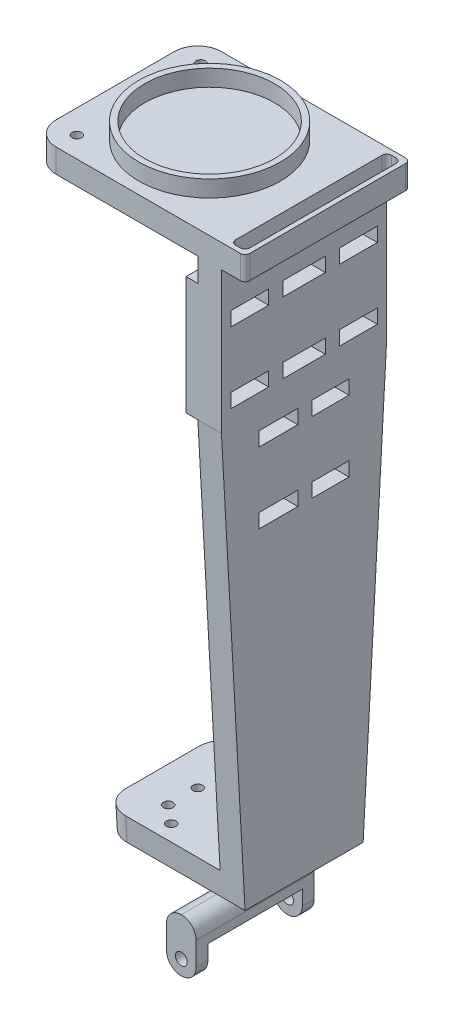
from build123d import *

# Parameters (mm, degrees)
SKETCH1_W                = 80
SKETCH1_H                = 70
BOSS_EXTRUDE1_DEPTH      = 10
SKETCH2_W                = 10
SKETCH2_H                = 70
BOSS_EXTRUDE2_DEPTH      = 450
SKETCH3_R                = 30
SKETCH3_R_2              = 27.5
BOSS_EXTRUDE3_DEPTH      = 7
SKETCH6_R                = 2
CUT_EXTRUDE3_DEPTH       = 27
SKETCH7_W                = 70
SKETCH7_H                = 210
CUT_EXTRUDE4_DEPTH       = 27
CUT_EXTRUDE5_DEPTH       = 70
BOSS_EXTRUDE5_DEPTH      = 50
SKETCH12_R               = 10
SKETCH12_R_2             = 7.5
SKETCH12_R_3             = 2.5
BOSS_EXTRUDE6_DEPTH      = 25
SKETCH13_R               = 2
CUT_EXTRUDE6_DEPTH       = 25
SKETCH14_W               = 24
SKETCH14_H               = 50
SKETCH14_W_2             = 20
SKETCH14_H_2             = 46
BOSS_EXTRUDE7_DEPTH      = 5
SKETCH15_W               = 24
SKETCH15_H               = 50
SKETCH15_W_2             = 20
SKETCH15_H_2             = 46
BOSS_EXTRUDE8_DEPTH      = 5
SKETCH16_W               = 22
SKETCH16_H               = 2
BOSS_EXTRUDE9_DEPTH      = 5
SKETCH17_W               = 46
SKETCH17_H               = 50
SKETCH17_W_2             = 19.659007001
SKETCH17_H_2             = 46
SKETCH17_W_3             = 20.340992999
BOSS_EXTRUDE10_DEPTH     = 5
SKETCH18_W               = 16
SKETCH18_H               = 6
SKETCH18_W_2             = 18
CUT_EXTRUDE8_DEPTH       = 10
SKETCH19_W               = 15.659007001
SKETCH19_H               = 6
SKETCH19_W_2             = 16.340992999
CUT_EXTRUDE9_DEPTH       = 10
FILLET1_R                = 10
FILLET2_R                = 10
SKETCH20_W               = 70
SKETCH20_H               = 10
BOSS_EXTRUDE11_DEPTH     = 10
SKETCH21_W               = 6
SKETCH21_H               = 66
CUT_EXTRUDE10_DEPTH      = 10
FILLET3_R                = 2
FILLET4_R                = 2
FILLET5_R                = 2
SKETCH23_W               = 25.167549862
SKETCH23_H               = 25.727851888
CUT_EXTRUDE12_DEPTH      = 116
SKETCH25_R               = 6.25
BOSS_EXTRUDE12_DEPTH     = 15
SKETCH26_W               = 12.5
SKETCH26_H               = 21
SKETCH26_H_2             = 4
BOSS_EXTRUDE13_DEPTH     = 10
SKETCH27_W               = 12.5
SKETCH27_H               = 5
BOSS_EXTRUDE15_DEPTH     = 12.5
FILLET8_R                = 6.25
CUT_EXTRUDE14_DEPTH      = 52.5
CUT_EXTRUDE14_DEPTH_BACK = 12.5
SKETCH29_R               = 2.5
FILLET9_R                = 6.25
SKETCH30_W               = 1
SKETCH30_H               = 46
BOSS_EXTRUDE16_DEPTH     = 5


# Some blends are built 0.0001 mm under size
with BuildPart() as part:
    # Sketch1 → Boss-Extrude1 (new body)
    with BuildSketch(Plane(origin=(0, 0, 0), x_dir=(1, 0, 0), z_dir=(0, 1, 0))):
        with Locations((-40, -35)):
            Rectangle(SKETCH1_W, SKETCH1_H)
    extrude(amount=BOSS_EXTRUDE1_DEPTH)

    # Sketch2 → Boss-Extrude2 (add)
    with BuildSketch(Plane.XZ):
        with Locations((-5, 35)):
            Rectangle(SKETCH2_W, SKETCH2_H)
    extrude(amount=BOSS_EXTRUDE2_DEPTH)

    # Sketch3 → Boss-Extrude3 (add)
    with BuildSketch(Plane(origin=(0, 10, 0), x_dir=(1, 0, 0), z_dir=(0, 1, 0))):
        with Locations(Location((-40, -35, 0), (0, 0, 90))):
            Circle(SKETCH3_R)
        with Locations(Location((-40, -35, 0), (0, 0, 270))):
            Circle(SKETCH3_R_2, mode=Mode.SUBTRACT)
    extrude(amount=BOSS_EXTRUDE3_DEPTH)

    # Sketch6 → Cut-Extrude3 (cut)
    with BuildSketch(Plane(origin=(0, 10, 0), x_dir=(1, 0, 0), z_dir=(0, 1, 0))):
        with Locations(Location((-70, -61.25, 0), (0, 0, 270))):
            Circle(SKETCH6_R)
        with Locations(Location((-70, -8.75, 0), (0, 0, 270))):
            Circle(SKETCH6_R)
    extrude(amount=-CUT_EXTRUDE3_DEPTH, mode=Mode.SUBTRACT)

    # Sketch7 → Cut-Extrude4 (cut)
    with BuildSketch(Plane.ZY.offset(10)):
        with Locations((35, -345)):
            Rectangle(SKETCH7_W, SKETCH7_H)
    extrude(amount=-CUT_EXTRUDE4_DEPTH, mode=Mode.SUBTRACT)

    # Sketch10 → Cut-Extrude5 (cut)
    with BuildSketch(Plane.ZY.offset(10)):
        Polygon((0, -60), (10, -240), (0, -240), align=None)
        Polygon((70, -60), (60, -240), (70, -240), align=None)
    extrude(amount=-CUT_EXTRUDE5_DEPTH, mode=Mode.SUBTRACT)

    # Sketch11 → Boss-Extrude5 (add)
    with BuildSketch(Plane.ZY.offset(10)):
        Polygon((10.116578541, -240), (60, -240), (60.555555556, -230), (9.444444444, -230), align=None)
    extrude(amount=BOSS_EXTRUDE5_DEPTH)

    # Sketch12 → Boss-Extrude6 (add)
    # profile 1 of 2: a face of its own
    with BuildSketch(Plane.XZ.offset(240)):
        with Locations(Location((-30, 35, 0), (0, 0, 90))):
            Circle(SKETCH12_R)
        with Locations(Location((-30, 35, 0), (0, 0, 270))):
            Circle(SKETCH12_R_2, mode=Mode.SUBTRACT)
    # profile 2 of 2: a face of its own
    with BuildSketch(Plane.XZ.offset(240)):
        with Locations(Location((-30, 35, 0), (0, 0, 90))):
            Circle(SKETCH12_R_3)
    extrude(amount=BOSS_EXTRUDE6_DEPTH)

    # Sketch13 → Cut-Extrude6 (cut)
    with BuildSketch(Plane(origin=(0, -240, 0), x_dir=(-1, 0, 0), z_dir=(0, -1, 0))):
        with Locations(Location((45, -47.529144635, 0), (0, 0, 90))):
            Circle(SKETCH13_R)
        with Locations(Location((45, -22.558289271, 0), (0, 0, 90))):
            Circle(SKETCH13_R)
        with Locations(Location((45, -35.043716953, 0), (0, 0, 90))):
            Circle(SKETCH13_R)
        with Locations(Location((37.5, -53.764572318, 0), (0, 0, 90))):
            Circle(SKETCH13_R)
        with Locations(Location((37.5, -16.308289271, 0), (0, 0, 90))):
            Circle(SKETCH13_R)
    extrude(amount=-CUT_EXTRUDE6_DEPTH, mode=Mode.SUBTRACT)

    # Sketch14 → Boss-Extrude7 (add)
    with BuildSketch(Plane.ZY.offset(10)):
        with Locations((12, -35)):
            Rectangle(SKETCH14_W, SKETCH14_H)
        with Locations((12, -35)):
            Rectangle(SKETCH14_W_2, SKETCH14_H_2, mode=Mode.SUBTRACT)
    extrude(amount=BOSS_EXTRUDE7_DEPTH)

    # Sketch15 → Boss-Extrude8 (add)
    with BuildSketch(Plane.ZY.offset(10)):
        with Locations((58, -35)):
            Rectangle(SKETCH15_W, SKETCH15_H)
        with Locations((58, -35)):
            Rectangle(SKETCH15_W_2, SKETCH15_H_2, mode=Mode.SUBTRACT)
    extrude(amount=BOSS_EXTRUDE8_DEPTH)

    # Sketch16 → Boss-Extrude9 (add)
    with BuildSketch(Plane.ZY.offset(10)):
        with Locations((35, -11)):
            Rectangle(SKETCH16_W, SKETCH16_H)
        with Locations((35, -59)):
            Rectangle(SKETCH16_W, SKETCH16_H)
    extrude(amount=BOSS_EXTRUDE9_DEPTH)

    # Sketch17 → Boss-Extrude10 (add)
    with BuildSketch(Plane.ZY.offset(10)):
        with Locations((35, -85)):
            Rectangle(SKETCH17_W, SKETCH17_H)
        with Locations((23.8295035, -85)):
            Rectangle(SKETCH17_W_2, SKETCH17_H_2, mode=Mode.SUBTRACT)
        with Locations((45.8295035, -85)):
            Rectangle(SKETCH17_W_3, SKETCH17_H_2, mode=Mode.SUBTRACT)
    extrude(amount=BOSS_EXTRUDE10_DEPTH)

    # Sketch18 → Cut-Extrude8 (cut)
    with BuildSketch(Plane.ZY.offset(10)):
        with Locations((12, -20)):
            Rectangle(SKETCH18_W, SKETCH18_H)
        with Locations((35, -20)):
            Rectangle(SKETCH18_W_2, SKETCH18_H)
        with Locations((58, -20)):
            Rectangle(SKETCH18_W, SKETCH18_H)
        with Locations((12, -50)):
            Rectangle(SKETCH18_W, SKETCH18_H)
        with Locations((35, -50)):
            Rectangle(SKETCH18_W_2, SKETCH18_H)
        with Locations((58, -50)):
            Rectangle(SKETCH18_W, SKETCH18_H)
    extrude(amount=-CUT_EXTRUDE8_DEPTH, mode=Mode.SUBTRACT)

    # Sketch19 → Cut-Extrude9 (cut)
    with BuildSketch(Plane.ZY.offset(10)):
        with Locations((23.829503501, -70)):
            Rectangle(SKETCH19_W, SKETCH19_H)
        with Locations((23.829503501, -100)):
            Rectangle(SKETCH19_W, SKETCH19_H)
        with Locations((45.8295035, -70)):
            Rectangle(SKETCH19_W_2, SKETCH19_H)
        with Locations((45.8295035, -100)):
            Rectangle(SKETCH19_W_2, SKETCH19_H)
    extrude(amount=-CUT_EXTRUDE9_DEPTH, mode=Mode.SUBTRACT)

    # Fillet1
    fillet1_edges = [part.edges().sort_by_distance(p)[0] for p in [
        (-80, 5, 0),
        (-80, 5, 70),
    ]]
    fillet(fillet1_edges, radius=FILLET1_R)

    # Fillet2
    fillet2_edges = [part.edges().sort_by_distance(p)[0] for p in [
        (-60, -235, 9.780511493),
        (-60, -235, 60.277777778),
    ]]
    fillet(fillet2_edges, radius=FILLET2_R)

    # Sketch20 → Boss-Extrude11 (add)
    with BuildSketch(Plane(origin=(0, 0, 0), x_dir=(0, 0, -1), z_dir=(1, 0, 0))):
        with Locations((-35, 5)):
            Rectangle(SKETCH20_W, SKETCH20_H)
    extrude(amount=BOSS_EXTRUDE11_DEPTH)

    # Sketch21 → Cut-Extrude10 (cut)
    with BuildSketch(Plane.XZ):
        with Locations((5, 35)):
            Rectangle(SKETCH21_W, SKETCH21_H)
    extrude(amount=-CUT_EXTRUDE10_DEPTH, mode=Mode.SUBTRACT)

    # Fillet3
    fillet3_edges = [part.edges().sort_by_distance(p)[0] for p in [
        (10, 5, 70),
        (10, 5, 0),
    ]]
    fillet(fillet3_edges, radius=FILLET3_R)

    # Fillet4
    fillet4_edges = [part.edges().sort_by_distance(p)[0] for p in [
        (8, 5, 68),
        (8, 5, 2),
    ]]
    fillet(fillet4_edges, radius=FILLET4_R)

    # Fillet5
    fillet5_edges = [part.edges().sort_by_distance(p)[0] for p in [
        (2, 5, 2),
        (2, 5, 68),
    ]]
    fillet(fillet5_edges, radius=FILLET5_R)

    # Sketch23 → Cut-Extrude12 (cut)
    with BuildSketch(Plane.XZ.offset(240)):
        with Locations((-28.923795104, 37.128742303)):
            Rectangle(SKETCH23_W, SKETCH23_H)
    extrude(amount=CUT_EXTRUDE12_DEPTH, mode=Mode.SUBTRACT)

    # Sketch25 → Boss-Extrude12 (add)
    with BuildSketch(Plane(origin=(0, -240, 0), x_dir=(-1, 0, 0), z_dir=(0, -1, 0))):
        with Locations(Location((26.99513388, -35, 0), (0, 0, 270))):
            Circle(SKETCH25_R)
    extrude(amount=BOSS_EXTRUDE12_DEPTH)

    # Sketch26 → Boss-Extrude13 (add)
    with BuildSketch(Plane(origin=(0, -255, 0), x_dir=(-1, 0, 0), z_dir=(0, -1, 0))):
        with Locations((26.99513388, -45.5)):
            Rectangle(SKETCH26_W, SKETCH26_H)
        with Locations((26.99513388, -24.5)):
            Rectangle(SKETCH26_W, SKETCH26_H)
        with Locations((26.99513388, -12)):
            Rectangle(SKETCH26_W, SKETCH26_H_2)
        with Locations((26.99513388, -58)):
            Rectangle(SKETCH26_W, SKETCH26_H_2)
    extrude(amount=BOSS_EXTRUDE13_DEPTH)

    # Sketch27 → Boss-Extrude15 (add)
    with BuildSketch(Plane.XZ.offset(265)):
        with Locations((-26.99513388, 12.5)):
            Rectangle(SKETCH27_W, SKETCH27_H)
        with Locations((-26.99513388, 57.5)):
            Rectangle(SKETCH27_W, SKETCH27_H)
    extrude(amount=BOSS_EXTRUDE15_DEPTH)

    # Fillet8
    fillet8_edges = [part.edges().sort_by_distance(p)[0] for p in [
        (-20.74513388, -277.5, 57.5),
        (-33.24513388, -277.5, 57.5),
        (-20.74513388, -277.5, 12.5),
        (-33.24513388, -277.5, 12.5),
    ]]
    fillet(fillet8_edges, radius=FILLET8_R - 0.0001)  # a hair under: the kernel refuses the full size

    # Sketch29 → Cut-Extrude14 (cut, two sides: drawn at the far end of the back side and taken through both)
    with BuildSketch(Plane(origin=(0, 0, 55), x_dir=(-1, 0, 0), z_dir=(0, 0, -1)).offset(-CUT_EXTRUDE14_DEPTH_BACK)):
        with Locations(Location((26.99513388, -271.25, 0), (0, 0, 180))):
            Circle(SKETCH29_R)
    extrude(amount=CUT_EXTRUDE14_DEPTH + CUT_EXTRUDE14_DEPTH_BACK, mode=Mode.SUBTRACT)

    # Fillet9
    # the kernel refuses this fillet: 6.25 mm, written as the material it takes off along each edge
    with BuildSketch(Plane(origin=(-20.74513388, -255, 35), x_dir=(0, -1, 0), z_dir=(0, 0, 1))) as fillet9_piece_1_section:
        with BuildLine():
            CenterArc((FILLET9_R, -FILLET9_R), FILLET9_R, 90, 90)
            Line((0, -FILLET9_R), (0, 0))
            Line((0, 0), (FILLET9_R, 0))
        make_face()
    fillet9_piece_1 = extrude(amount=40.625, mode=Mode.PRIVATE)
    fillet9_piece_1 = fillet9_piece_1 - Plane(origin=(-26.99513388, -256.446444019, 35), x_dir=(0, 0, 1), z_dir=(0, 1, 0)) * Cylinder(6.25, 107, mode=Mode.PRIVATE)
    add(fillet9_piece_1, mode=Mode.SUBTRACT)
    with BuildSketch(Plane(origin=(-33.24513388, -255, 34.999999912), x_dir=(0, -1, 0), z_dir=(0, 0, 1))) as fillet9_piece_2_section:
        with BuildLine():
            CenterArc((FILLET9_R, FILLET9_R), FILLET9_R, 180, 90)
            Line((0, FILLET9_R), (0, 0))
            Line((0, 0), (FILLET9_R, 0))
        make_face()
    fillet9_piece_2 = extrude(amount=40.625000088, mode=Mode.PRIVATE)
    fillet9_piece_2 = fillet9_piece_2 - Plane(origin=(-26.99513388, -256.446444017, 35), x_dir=(0, 0, 1), z_dir=(0, 1, 0)) * Cylinder(6.25, 107, mode=Mode.PRIVATE)
    add(fillet9_piece_2, mode=Mode.SUBTRACT)
    with BuildSketch(Plane(origin=(-20.74513388, -255, -5.625), x_dir=(-1, 0, 0), z_dir=(0, 0, 1))) as fillet9_piece_3_section:
        with BuildLine():
            CenterArc((FILLET9_R, FILLET9_R), FILLET9_R, 180, 90)
            Line((0, FILLET9_R), (0, 0))
            Line((0, 0), (FILLET9_R, 0))
        make_face()
    fillet9_piece_3 = extrude(amount=40.625, mode=Mode.PRIVATE)
    fillet9_piece_3 = fillet9_piece_3 - Plane(origin=(-26.99513388, -256.446444019, 35), x_dir=(0, 0, 1), z_dir=(0, 1, 0)) * Cylinder(6.25, 107, mode=Mode.PRIVATE)
    add(fillet9_piece_3, mode=Mode.SUBTRACT)
    with BuildSketch(Plane(origin=(-33.24513388, -255, -5.625), x_dir=(0, -1, 0), z_dir=(0, 0, 1))) as fillet9_piece_4_section:
        with BuildLine():
            CenterArc((FILLET9_R, FILLET9_R), FILLET9_R, 180, 90)
            Line((0, FILLET9_R), (0, 0))
            Line((0, 0), (FILLET9_R, 0))
        make_face()
    fillet9_piece_4 = extrude(amount=40.624999912, mode=Mode.PRIVATE)
    fillet9_piece_4 = fillet9_piece_4 - Plane(origin=(-26.99513388, -256.446444019, 35), x_dir=(0, 0, 1), z_dir=(0, 1, 0)) * Cylinder(6.25, 107, mode=Mode.PRIVATE)
    add(fillet9_piece_4, mode=Mode.SUBTRACT)

    # Sketch30 → Boss-Extrude16 (add)
    with BuildSketch(Plane.ZY.offset(10)):
        with Locations((45.5, -35)):
            Rectangle(SKETCH30_W, SKETCH30_H)
        with Locations((24.5, -35)):
            Rectangle(SKETCH30_W, SKETCH30_H)
    extrude(amount=BOSS_EXTRUDE16_DEPTH)


solid = part.part
